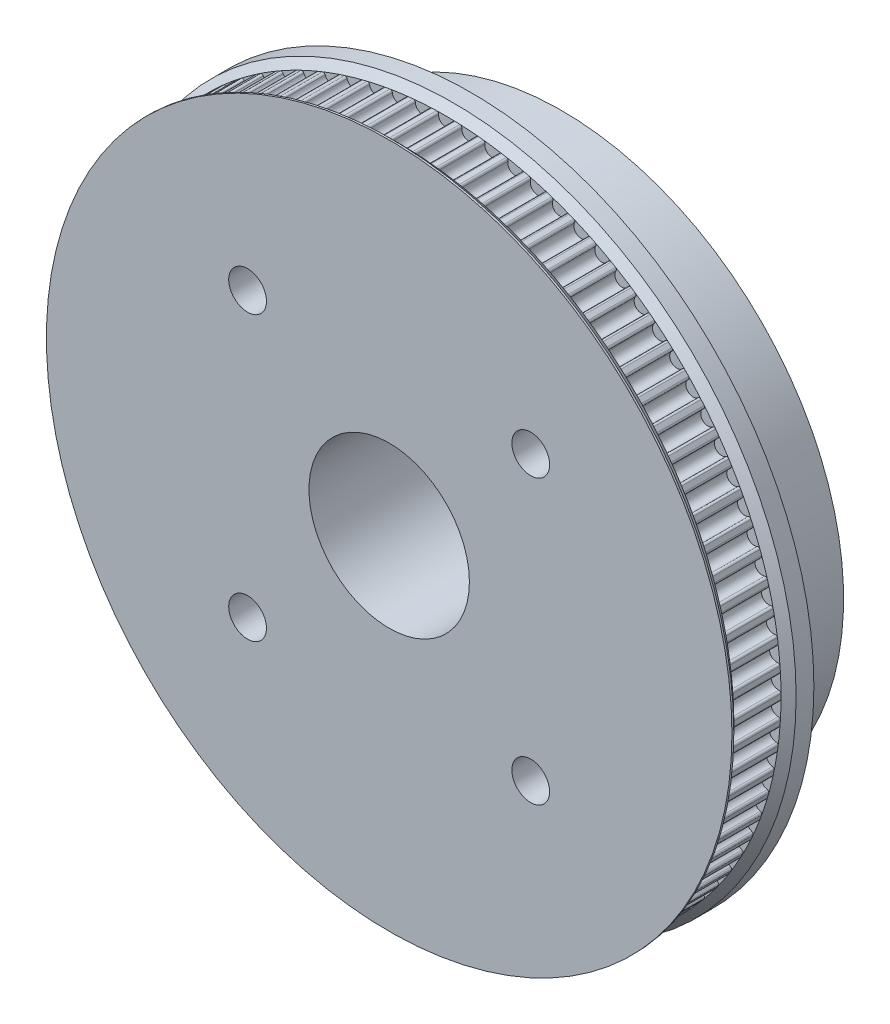
from build123d import *

# Parameters (mm, degrees)
SKETCH1_R           = 71.029724391
BOSS_EXTRUDE1_DEPTH = 10
CUT_EXTRUDE1_DEPTH  = 101.947726543
CIRPATTERN3_COUNT   = 90
SKETCH10_R          = 72.629724391
BOSS_EXTRUDE3_DEPTH = 3.365
SKETCH11_R          = 59.75
BOSS_EXTRUDE4_DEPTH = 19.175
SKETCH12_R          = 2.15
CUT_EXTRUDE6_DEPTH  = 110.019839159
SKETCH13_R          = 4
CUT_EXTRUDE7_DEPTH  = 10
SKETCH14_R          = 17
CUT_EXTRUDE8_DEPTH  = 110.019839159


with BuildPart() as part:
    # Sketch1 → Boss-Extrude1 (new body)
    with BuildSketch(Plane.XY):
        Circle(SKETCH1_R)
    extrude(amount=BOSS_EXTRUDE1_DEPTH)

    # Sketch1<5> → Cut-Extrude1 (cut, through all)
    with BuildSketch(Plane.XY):
        with BuildLine():
            ThreePointArc((3.523854408, 70.9422596), (3.258115698, 70.954960568), (2.992331281, 70.966666123))
            ThreePointArc((2.992331281, 70.966666123), (3.300458942, 70.817165102), (3.401631166, 70.489968843))
            ThreePointArc((3.401631166, 70.489968843), (6.389656914, 69.925169615), (3.523854408, 70.9422596))
        make_face()
        with BuildLine():
            ThreePointArc((1.433411393, 71.015259479), (-1.496358772, 70.200555347), (1.523786697, 70.555544627))
            ThreePointArc((1.523786697, 70.555544627), (1.647536515, 70.874886412), (1.965342224, 71.002529371))
            ThreePointArc((1.965342224, 71.002529371), (1.699388729, 71.009392513), (1.433411393, 71.015259479))
        make_face()
    cut_extrude1 = extrude(amount=CUT_EXTRUDE1_DEPTH, mode=Mode.SUBTRACT)

    # CirPattern3: Cut-Extrude1 ×90 about axis
    cirpattern3_axis = Axis((0, 0, 10), (0, 0, 1))
    for i in range(1, CIRPATTERN3_COUNT):
        add(cut_extrude1.rotate(cirpattern3_axis, i * 360 / CIRPATTERN3_COUNT), mode=Mode.SUBTRACT)

    # Sketch5 → Revolve1 (revolve)
    with BuildSketch(Plane(origin=(0, 0, 0), x_dir=(0, 0, -1), z_dir=(1, 0, 0))):
        Polygon((0, 71.029724391), (0, 0), (2, 0), (2, 72.629724391), (1.6, 72.629724391), align=None)
    revolve1 = revolve(axis=Axis((0, 0, -1.6), (0, 0, -1)))

    # Mirror1: Revolve1 across plane
    add(revolve1.mirror(Plane.XY.offset(5)))

    # Sketch10 → Boss-Extrude3 (add)
    with BuildSketch(Plane(origin=(0, 0, -2), x_dir=(-1, 0, 0), z_dir=(0, 0, -1))):
        Circle(SKETCH10_R)
    extrude(amount=BOSS_EXTRUDE3_DEPTH)

    # Sketch11 → Boss-Extrude4 (add)
    with BuildSketch(Plane(origin=(0, 0, -5.365), x_dir=(-1, 0, 0), z_dir=(0, 0, -1))):
        Circle(SKETCH11_R)
    extrude(amount=BOSS_EXTRUDE4_DEPTH)

    # Sketch12 → Cut-Extrude6 (cut, through all)
    with BuildSketch(Plane.XY.offset(12)):
        with Locations((-30, 30)):
            Circle(SKETCH12_R)
        with Locations((30, 30)):
            Circle(SKETCH12_R)
        with Locations((30, -30)):
            Circle(SKETCH12_R)
        with Locations((-30, -30)):
            Circle(SKETCH12_R)
    extrude(amount=-CUT_EXTRUDE6_DEPTH, mode=Mode.SUBTRACT)

    # Sketch13 → Cut-Extrude7 (cut)
    with BuildSketch(Plane.XY.offset(12)):
        with Locations((-30, 30)):
            Circle(SKETCH13_R)
        with Locations((30, 30)):
            Circle(SKETCH13_R)
        with Locations((30, -30)):
            Circle(SKETCH13_R)
        with Locations((-30, -30)):
            Circle(SKETCH13_R)
    extrude(amount=-CUT_EXTRUDE7_DEPTH, mode=Mode.SUBTRACT)

    # Sketch14 → Cut-Extrude8 (cut, through all)
    with BuildSketch(Plane.XY.offset(12)):
        Circle(SKETCH14_R)
    extrude(amount=-CUT_EXTRUDE8_DEPTH, mode=Mode.SUBTRACT)


solid = part.part
